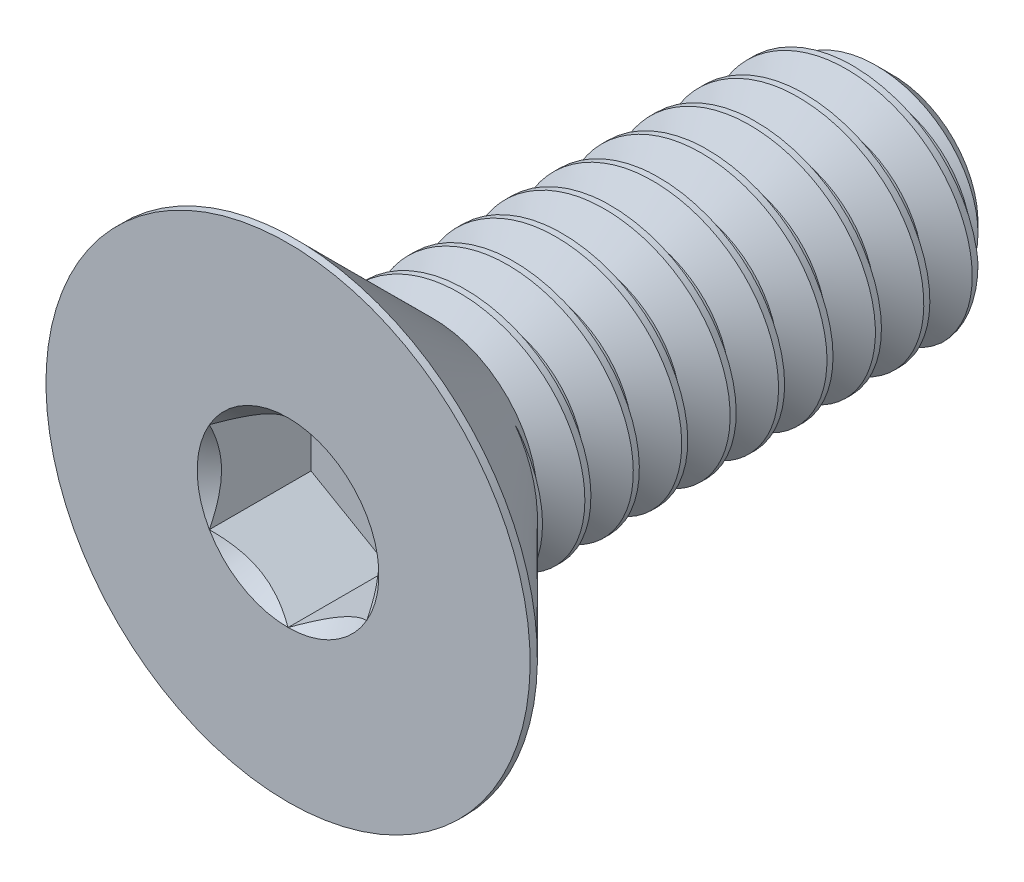
from build123d import *

# Parameters (mm, degrees)
CHAMFER1_SIZE      = 0.3
CUT_EXTRUDE2_DEPTH = 0.84
CUT_SWEEP1_PITCH   = 0.4


with BuildPart() as part:
    # Sketch1 → Revolve1 (revolve)
    with BuildSketch(Plane(origin=(0, 0, 0), x_dir=(0, 0, -1), z_dir=(1, 0, 0)), mode=Mode.PRIVATE) as revolve1_sk:
        Polygon((-1.3, 1), (2.5, 1), (2.5, 0), (-1.66, 0), (-1.66, 1), align=None)
    revolve(revolve1_sk.sketch.rotate(Axis((0, 0, 1.66), (0, 0, -1)), 180), axis=Axis((0, 0, 1.66), (0, 0, -1)))

    # Chamfer1
    chamfer1_edges = [part.edges().sort_by_distance(p)[0] for p in [
        (0, 1, -2.5),
    ]]
    chamfer(chamfer1_edges, length=CHAMFER1_SIZE)

    # Cut-Sweep1: the profile of Sketch13 screwed along a right-hand helix of 12.5 turns, 6 arcs to a turn; built about Z, then put on its axis
    cut_sweep1_z = Axis((0, 0, 0), (0, 0, 1))
    cut_sweep1_corners = [(1.021650635, 0, 0.0125), (1.021650635, 0, -0.3625), (0.740192379, 0, -0.2), (0.740192379, 0, -0.15)]
    with BuildLine(mode=Mode.PRIVATE) as cut_sweep1_profile:
        Line(cut_sweep1_corners[0], cut_sweep1_corners[1])
        Line(cut_sweep1_corners[1], cut_sweep1_corners[2])
        Line(cut_sweep1_corners[2], cut_sweep1_corners[3])
        Line(cut_sweep1_corners[3], cut_sweep1_corners[0])
    cut_sweep1_cap = Face(cut_sweep1_profile.wire())
    cut_sweep1_turn_angles = [0, 30, 60, 90, 120, 150, 180, 210, 240, 270, 300, 330, 360]
    cut_sweep1_turn_weights = [1, 0.8660254037844387, 1, 0.8660254037844387, 1, 0.8660254037844387, 1, 0.8660254037844387, 1, 0.8660254037844387, 1, 0.8660254037844387, 1]
    cut_sweep1_turn_rails = [Edge.make_bspline([Vector(p[0], p[1], 0).rotate(cut_sweep1_z, cut_sweep1_turn_angles[k]) / cut_sweep1_turn_weights[k] + Vector(0, 0, p[2] + CUT_SWEEP1_PITCH * cut_sweep1_turn_angles[k] / 360) for k in range(13)], [0, 0, 0, 1, 1, 2, 2, 3, 3, 4, 4, 5, 5, 6, 6, 6], 2, cut_sweep1_turn_weights) for p in cut_sweep1_corners]
    cut_sweep1_turn_sides = [Face.make_surface_from_curves(cut_sweep1_turn_rails[p[0]], cut_sweep1_turn_rails[p[1]]) for p in [(0, 1), (1, 2), (2, 3), (3, 0)]]
    cut_sweep1_last_angles = [4320, 4350, 4380, 4410, 4440, 4470, 4500]
    cut_sweep1_last_weights = [1, 0.8660254037844387, 1, 0.8660254037844387, 1, 0.866025403784399, 1]
    cut_sweep1_last_rails = [Edge.make_bspline([Vector(p[0], p[1], 0).rotate(cut_sweep1_z, cut_sweep1_last_angles[k]) / cut_sweep1_last_weights[k] + Vector(0, 0, p[2] + CUT_SWEEP1_PITCH * cut_sweep1_last_angles[k] / 360) for k in range(7)], [0, 0, 0, 1, 1, 2, 2, 3, 3, 3], 2, cut_sweep1_last_weights) for p in cut_sweep1_corners]
    cut_sweep1_last_sides = [Face.make_surface_from_curves(cut_sweep1_last_rails[p[0]], cut_sweep1_last_rails[p[1]]) for p in [(0, 1), (1, 2), (2, 3), (3, 0)]]
    cut_sweep1 = Plane(origin=(0, 0, -2.5), x_dir=(0, 1, 0), z_dir=(0, 0, 1)) * Solid(Shell([*[p.moved(Location((0, 0, CUT_SWEEP1_PITCH * i))) for i in range(12) for p in cut_sweep1_turn_sides], *cut_sweep1_last_sides, cut_sweep1_cap, cut_sweep1_cap.rotate(cut_sweep1_z, 4500).moved(Location((0, 0, CUT_SWEEP1_PITCH * 4500 / 360)))]))
    add(cut_sweep1, mode=Mode.SUBTRACT)


with BuildPart() as body_2:
    # Sketch7 → Revolve2 (revolve)
    with BuildSketch(Plane(origin=(0, 0, 0), x_dir=(0, 0, -1), z_dir=(1, 0, 0)), mode=Mode.PRIVATE) as revolve2_sk:
        Polygon((-2.5, 2), (-2.44, 2), (-1.3, 0.86), (-1.3, 0), (-2.5, 0), align=None)
    revolve(revolve2_sk.sketch.rotate(Axis((0, 0, 2.5), (0, 0, -1)), 180), axis=Axis((0, 0, 2.5), (0, 0, -1)))

    # Sketch5 → Cut-Extrude2 (cut)
    with BuildSketch(Plane.XY.offset(2.5)):
        Polygon((0.65, -0.375277675), (0.65, 0.375277675), (0, 0.75055535), (-0.65, 0.375277675), (-0.65, -0.375277675), (0, -0.75055535), align=None)
    extrude(amount=-CUT_EXTRUDE2_DEPTH, mode=Mode.SUBTRACT)

    # Cut-Extrude3 cone 1 section (through the dimple's axis) → Cut-Extrude3 (revolve, cut)
    with BuildSketch(Plane(origin=(0, 0, 2.5), x_dir=(0, -1, 0), z_dir=(1, 0, 0))):
        Polygon((0, 0), (0.75055535, 0), (0, 0.75055535), align=None)
    revolve(axis=Axis((0, 0, 2.5), (0, 0, -1)), mode=Mode.SUBTRACT)

    # Combine1: union part
    add(part.part)


solid = body_2.part
